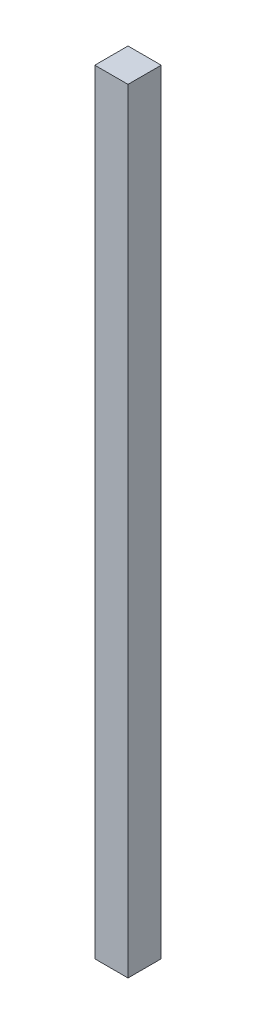
from build123d import *

# Parameters (mm, degrees)
ESQUISSE1_W        = 10
ESQUISSE1_H        = 233
BOSS_EXTRU_1_DEPTH = 10


with BuildPart() as part:
    # Esquisse1 → Boss.-Extru.1 (new body)
    with BuildSketch(Plane.XY):
        with Locations((-68.649945175, -5.041666667)):
            Rectangle(ESQUISSE1_W, ESQUISSE1_H)
    extrude(amount=BOSS_EXTRU_1_DEPTH)


solid = part.part
